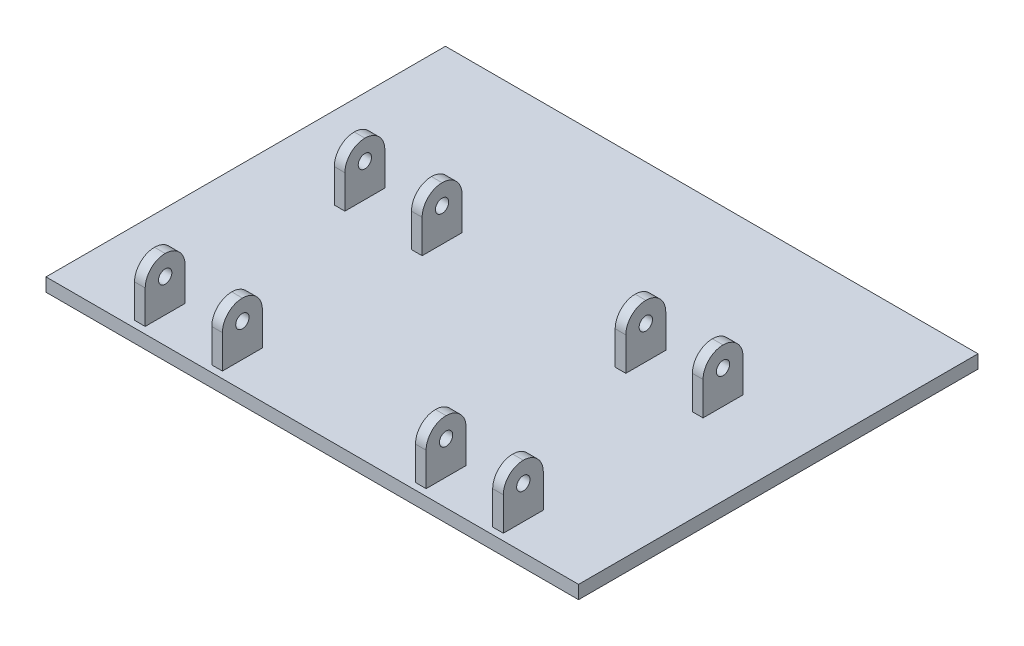
from build123d import *

# Parameters (mm, degrees)
SKETCH1_W           = 400
SKETCH1_H           = 300
BOSS_EXTRUDE1_DEPTH = 10
SKETCH2_W           = 8
SKETCH2_H           = 30
BOSS_EXTRUDE2_DEPTH = 40
SKETCH3_R           = 5
CUT_EXTRUDE1_DEPTH  = 374.607079697
FILLET1_R           = 15
SKETCH4_W           = 8
SKETCH4_H           = 30
BOSS_EXTRUDE3_DEPTH = 40
SKETCH5_R           = 5
CUT_EXTRUDE2_DEPTH  = 374.607079697
FILLET2_R           = 15


with BuildPart() as part:
    # Sketch1 → Boss-Extrude1 (new body)
    with BuildSketch(Plane(origin=(0, 0, 0), x_dir=(1, 0, 0), z_dir=(0, 1, 0))):
        Rectangle(SKETCH1_W, SKETCH1_H)
    extrude(amount=BOSS_EXTRUDE1_DEPTH)

    # Sketch2 → Boss-Extrude2 (add)
    with BuildSketch(Plane(origin=(0, 10, 0), x_dir=(1, 0, 0), z_dir=(0, 1, 0))):
        with Locations((-134.5, -130)):
            Rectangle(SKETCH2_W, SKETCH2_H)
        with Locations((-76.5, -130)):
            Rectangle(SKETCH2_W, SKETCH2_H)
        with Locations((76.5, -130)):
            Rectangle(SKETCH2_W, SKETCH2_H)
        with Locations((134.5, -130)):
            Rectangle(SKETCH2_W, SKETCH2_H)
    extrude(amount=BOSS_EXTRUDE2_DEPTH)

    # Sketch3 → Cut-Extrude1 (cut, through all)
    with BuildSketch(Plane(origin=(138.5, 0, 0), x_dir=(0, 0, -1), z_dir=(1, 0, 0))):
        with Locations((-130, 35)):
            Circle(SKETCH3_R)
    extrude(amount=-CUT_EXTRUDE1_DEPTH, mode=Mode.SUBTRACT)

    # Fillet1
    fillet1_edges = [part.edges().sort_by_distance(p)[0] for p in [
        (134.5, 50, 115),
        (134.5, 50, 145),
        (76.5, 50, 145),
        (76.5, 50, 115),
        (-76.5, 50, 115),
        (-134.5, 50, 115),
        (-76.5, 50, 145),
        (-134.5, 50, 145),
    ]]
    fillet(fillet1_edges, radius=FILLET1_R - 0.0001)  # a hair under: the kernel refuses the full size

    # Sketch4 → Boss-Extrude3 (add)
    with BuildSketch(Plane(origin=(0, 10, 0), x_dir=(1, 0, 0), z_dir=(0, 1, 0))):
        with Locations((-134.5, 20)):
            Rectangle(SKETCH4_W, SKETCH4_H)
        with Locations((-76.5, 20)):
            Rectangle(SKETCH4_W, SKETCH4_H)
        with Locations((134.5, 20)):
            Rectangle(SKETCH4_W, SKETCH4_H)
        with Locations((76.5, 20)):
            Rectangle(SKETCH4_W, SKETCH4_H)
    extrude(amount=BOSS_EXTRUDE3_DEPTH)

    # Sketch5 → Cut-Extrude2 (cut, through all)
    with BuildSketch(Plane(origin=(138.5, 0, 0), x_dir=(0, 0, -1), z_dir=(1, 0, 0))):
        with Locations((20, 35)):
            Circle(SKETCH5_R)
    extrude(amount=-CUT_EXTRUDE2_DEPTH, mode=Mode.SUBTRACT)

    # Fillet2
    fillet2_edges = [part.edges().sort_by_distance(p)[0] for p in [
        (-134.5, 50, -35),
        (-76.5, 50, -35),
        (134.5, 50, -35),
        (76.5, 50, -35),
        (-134.5, 50, -5),
        (-76.5, 50, -5),
        (76.5, 50, -5),
        (134.5, 50, -5),
    ]]
    fillet(fillet2_edges, radius=FILLET2_R - 0.0001)  # a hair under: the kernel refuses the full size


solid = part.part
